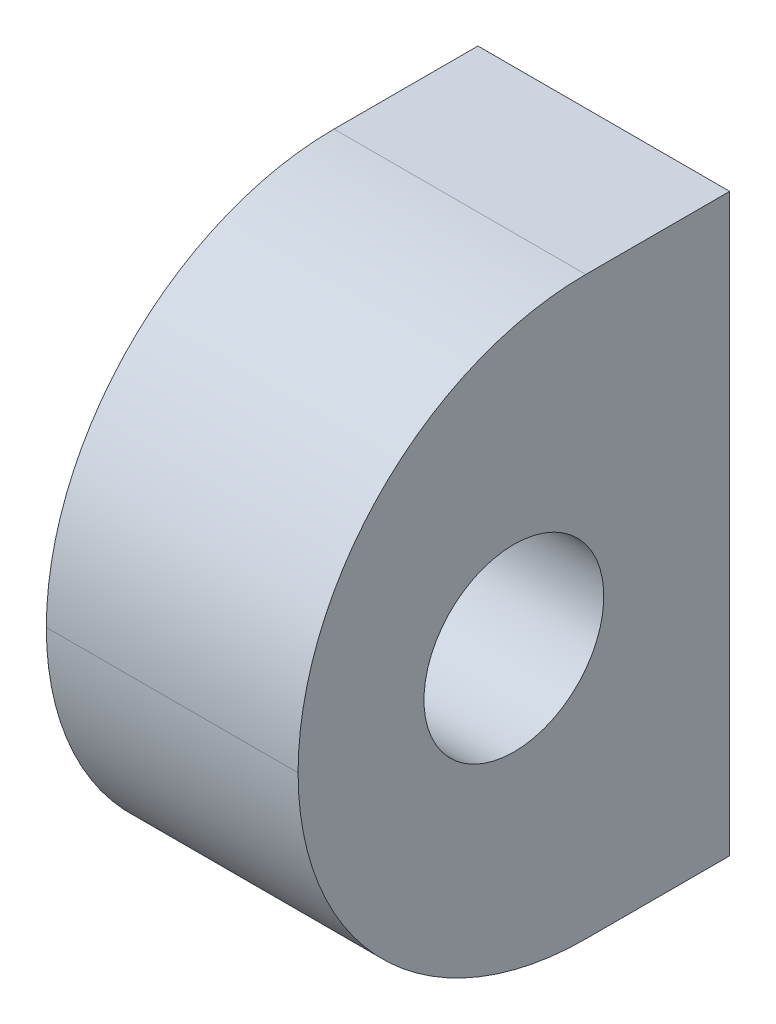
from build123d import *

# Parameters (mm, degrees)
SKETCH1_W           = 22.225
SKETCH1_H           = 50.8
BOSS_EXTRUDE1_DEPTH = 38.1
FILLET1_R           = 25.4
SKETCH2_R           = 7.9375
CUT_EXTRUDE1_DEPTH  = 38.1


with BuildPart() as part:
    # Sketch1 → Boss-Extrude1 (new body)
    with BuildSketch(Plane.XY):
        with Locations((11.1125, 25.4)):
            Rectangle(SKETCH1_W, SKETCH1_H)
    extrude(amount=BOSS_EXTRUDE1_DEPTH)

    # Fillet1
    fillet1_edges = [part.edges().sort_by_distance(p)[0] for p in [
        (11.1125, 0, 38.1),
        (11.1125, 50.8, 38.1),
    ]]
    fillet(fillet1_edges, radius=FILLET1_R - 0.0001)  # a hair under: the kernel refuses the full size

    # Sketch2 → Cut-Extrude1 (cut)
    with BuildSketch(Plane(origin=(22.225, 0, 0), x_dir=(0, 0, -1), z_dir=(1, 0, 0))):
        with Locations(Location((-19.05, 25.4, 0), (0, 0, 90))):
            Circle(SKETCH2_R)
    extrude(amount=-CUT_EXTRUDE1_DEPTH, mode=Mode.SUBTRACT)


solid = part.part
